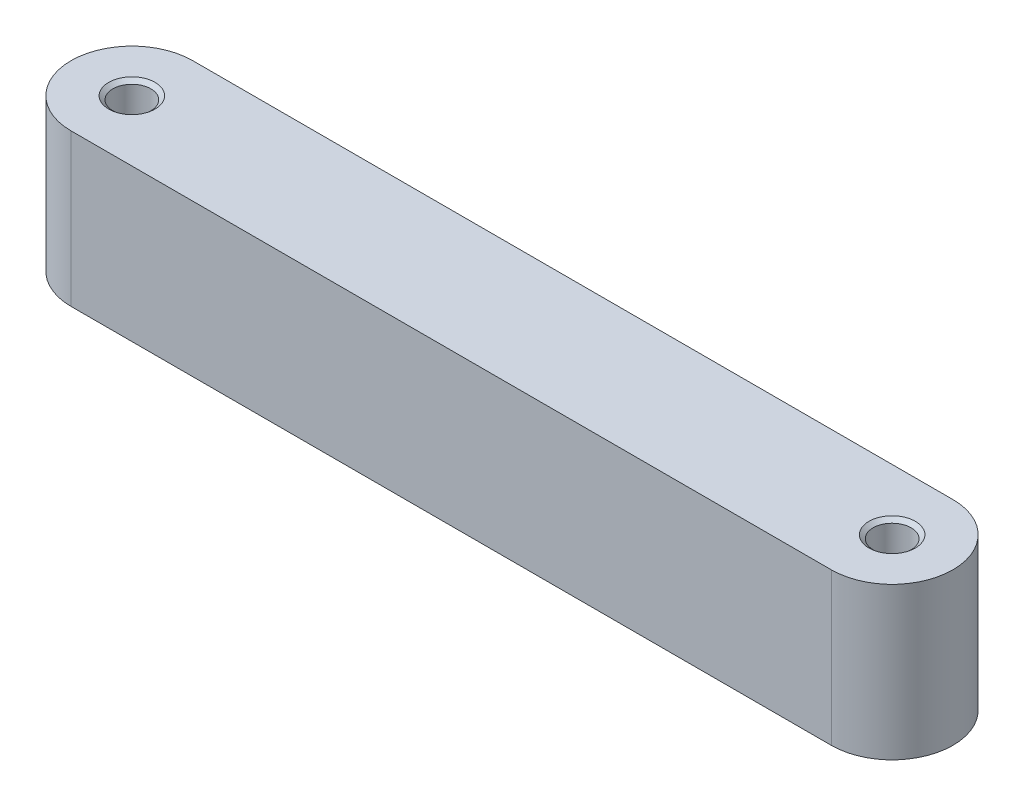
from build123d import *

# Parameters (mm, degrees)
BOSS_EXTRUDE1_DEPTH = 10


# Read off the part's stored shape, not the designer's step: M3x0.5 Tapped Hole1
with BuildPart() as part:
    # Sketch1 → Boss-Extrude1 (new body)
    with BuildSketch(Plane(origin=(0, 0, 0), x_dir=(1, 0, 0), z_dir=(0, 1, 0))):
        with BuildLine():
            Line((-25, 4), (25, 4))
            ThreePointArc((25, 4), (29, 0), (25, -4))
            Line((25, -4), (-25, -4))
            ThreePointArc((-25, -4), (-29, 0), (-25, 4))
        make_face()
    extrude(amount=BOSS_EXTRUDE1_DEPTH)

    # M3x0.5 Tapped Hole1 outline → M3x0.5 Tapped Hole1 (revolve, cut)
    with BuildSketch(Plane(origin=(-25, 0, 0), x_dir=(1, 0, 0), z_dir=(0, 0, 1))):
        Polygon((0, 0), (1.25, 0), (1.25, 9.769247601), (1.525, 10), (0, 10), align=None)
    revolve(axis=Axis((-25, 0, 0), (0, 1, 0)), mode=Mode.SUBTRACT)

    # M3x0.5 Tapped Hole1 2 outline → M3x0.5 Tapped Hole1 2 (revolve, cut)
    with BuildSketch(Plane(origin=(25, 0, 0), x_dir=(1, 0, 0), z_dir=(0, 0, 1))):
        Polygon((0, 0), (1.25, 0), (1.25, 9.769247601), (1.525, 10), (0, 10), align=None)
    revolve(axis=Axis((25, 0, 0), (0, 1, 0)), mode=Mode.SUBTRACT)


solid = part.part
